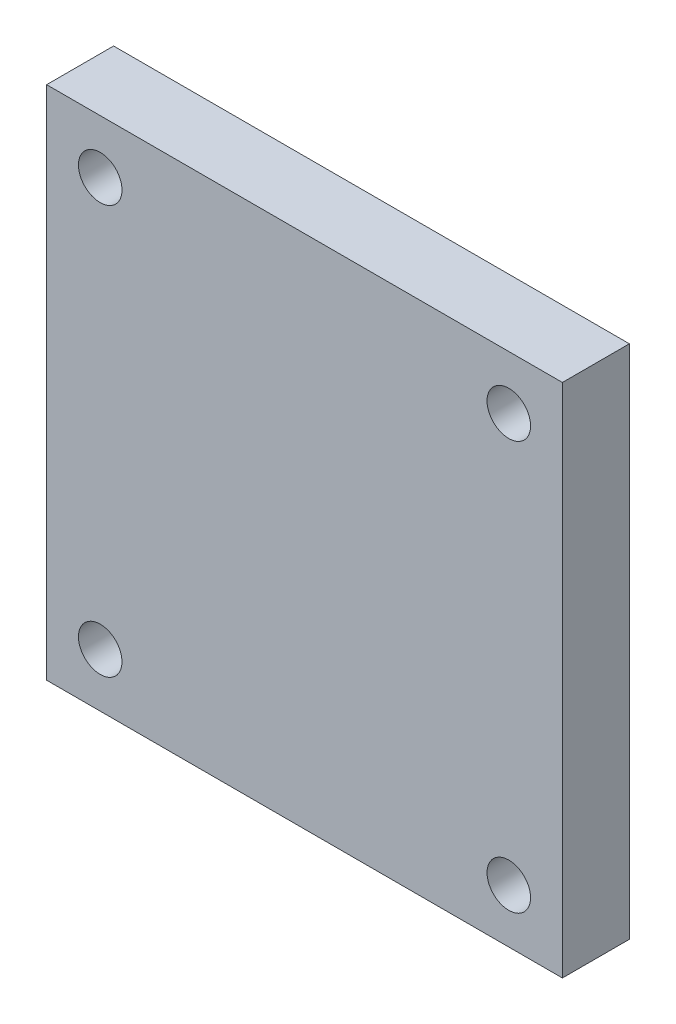
from build123d import *

# Parameters (mm, degrees)
SKETCH1_W           = 154
SKETCH1_H           = 154
SKETCH1_R           = 6.5
BOSS_EXTRUDE1_DEPTH = 10


with BuildPart() as part:
    # Sketch1 → Boss-Extrude1 (new, symmetric)
    with BuildSketch(Plane.XY):
        Rectangle(SKETCH1_W, SKETCH1_H)
        with Locations((-61, 61)):
            Circle(SKETCH1_R, mode=Mode.SUBTRACT)
        with Locations((61, 61)):
            Circle(SKETCH1_R, mode=Mode.SUBTRACT)
        with Locations((-61, -61)):
            Circle(SKETCH1_R, mode=Mode.SUBTRACT)
        with Locations((61, -61)):
            Circle(SKETCH1_R, mode=Mode.SUBTRACT)
    extrude(amount=BOSS_EXTRUDE1_DEPTH, both=True)


solid = part.part
